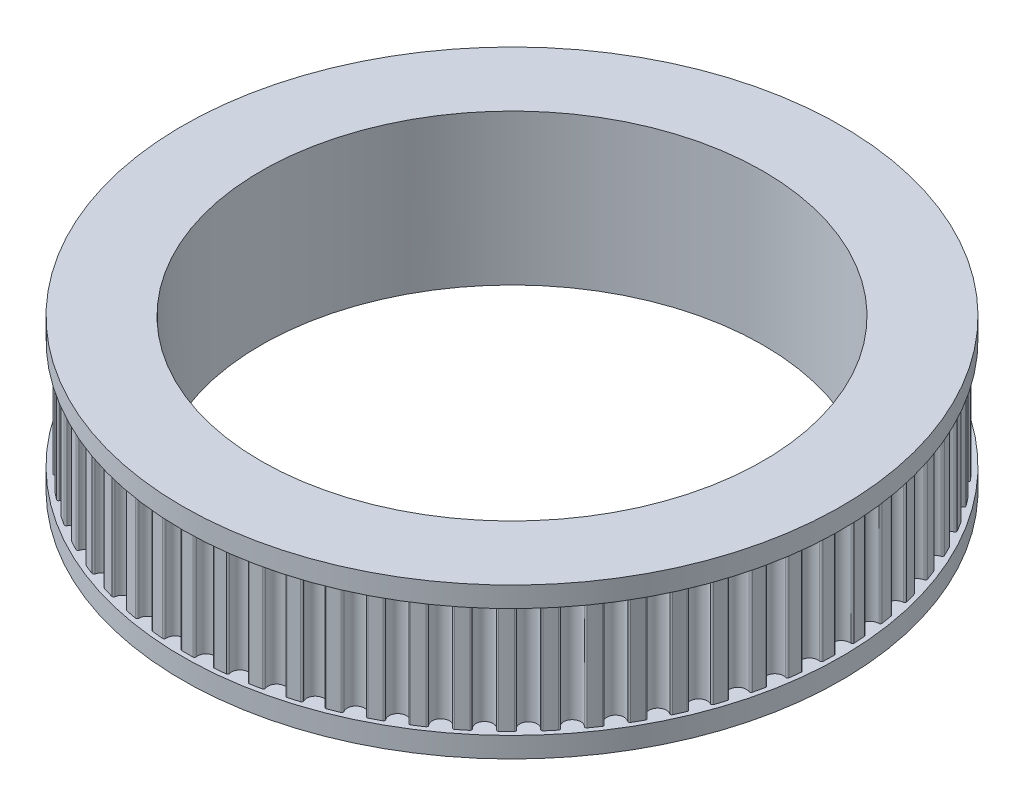
from build123d import *

# Parameters (mm, degrees)
SKETCH1_R                = 20.6901426
SKETCH1_R_2              = 16
BOSS_EXTRUDE1_DEPTH      = 7
CUT_EXTRUDE1_DEPTH       = 31.085943589
FILLET1_R                = 0.1
CIRPATTERN1_COUNT        = 65
FILLET1_OF_CIRPATTERN1_R = 0.1
SKETCH3_R                = 21
SKETCH3_R_2              = 16
BOSS_EXTRUDE2_DEPTH      = 1.3
BOSS_EXTRUDE3_START      = 1.3
SKETCH4_R                = 21
SKETCH4_R_2              = 16
BOSS_EXTRUDE3_DEPTH      = 1.3


with BuildPart() as part:
    # Sketch1 → Boss-Extrude1 (new body)
    with BuildSketch(Plane(origin=(0, 0, 0), x_dir=(1, 0, 0), z_dir=(0, 1, 0))):
        Circle(SKETCH1_R)
        Circle(SKETCH1_R_2, mode=Mode.SUBTRACT)
    extrude(amount=BOSS_EXTRUDE1_DEPTH)

    # Sketch2 → Cut-Extrude1 (cut, through all)
    with BuildSketch(Plane(origin=(0, 7, 0), x_dir=(1, 0, 0), z_dir=(0, 1, 0))):
        with BuildLine():
            ThreePointArc((-0.518485138, 20.683645084), (0, 19.9501426), (0.518485138, 20.683645084))
            ThreePointArc((0.518485138, 20.683645084), (0, 20.6901426), (-0.518485138, 20.683645084))
        make_face()
    cut_extrude1 = extrude(amount=-CUT_EXTRUDE1_DEPTH, mode=Mode.SUBTRACT)

    # Fillet1
    fillet1_edges = [part.edges().sort_by_distance(p)[0] for p in [
        (0.518485138, 3.5, -20.683645084),
        (-0.518485138, 3.5, -20.683645084),
    ]]
    fillet(fillet1_edges, radius=FILLET1_R)

    # CirPattern1: Cut-Extrude1 ×65 about axis
    cirpattern1_axis = Axis((0, 7, 0), (0, 1, 0))
    for i in range(1, CIRPATTERN1_COUNT):
        add(cut_extrude1.rotate(cirpattern1_axis, i * 360 / CIRPATTERN1_COUNT), mode=Mode.SUBTRACT)

    # Fillet1 of CirPattern1
    fillet1_of_cirpattern1_edges = [part.edges().sort_by_distance(p)[0] for p in [
        (-1.480195026, 3.5, -20.637127307),
        (-2.512324346, 3.5, -20.53704524),
        (-3.465055008, 3.5, -20.397926233),
        (-4.482706658, 3.5, -20.198696538),
        (-5.417562704, 3.5, -19.968275217),
        (-6.411235146, 3.5, -19.671758048),
        (-7.319488078, 3.5, -19.352185796),
        (-8.279903659, 3.5, -18.961149654),
        (-9.153073363, 3.5, -18.55541023),
        (-10.071264943, 3.5, -18.073506114),
        (-10.901198869, 3.5, -17.585387799),
        (-11.768593539, 3.5, -17.017115118),
        (-12.547542818, 3.5, -16.451175339),
        (-13.356041948, 3.5, -15.801839902),
        (-14.07673374, 3.5, -15.163362688),
        (-14.818788592, 3.5, -14.439027165),
        (-15.474493992, 3.5, -13.733973805),
        (-16.1431762, 3.5, -12.941401122),
        (-16.727773064, 3.5, -12.176354509),
        (-17.316839321, 3.5, -11.322944703),
        (-17.824869425, 3.5, -10.505047872),
        (-18.328819779, 3.5, -9.598769),
        (-18.755539783, 3.5, -8.735658434),
        (-19.169668985, 3.5, -7.784972178),
        (-19.511094719, 3.5, -6.884706506),
        (-19.831536157, 3.5, -5.898489168),
        (-20.084479821, 3.5, -4.969473928),
        (-20.308241619, 3.5, -3.956933553),
        (-20.470341547, 3.5, -3.007842712),
        (-20.595334501, 3.5, -1.978433116),
        (-20.665077208, 3.5, -1.018128078),
        (-20.690134294, 3.5, 0.018539417),
        (-20.666868612, 3.5, 0.981092543),
        (-20.591755877, 3.5, 2.015338853),
        (-20.475699032, 3.5, 2.971152968),
        (-20.301117784, 3.5, 3.993321614),
        (-20.093353367, 3.5, 4.933472537),
        (-19.820933625, 3.5, 5.934019806),
        (-19.523401475, 3.5, 6.849729603),
        (-19.155686748, 3.5, 7.819313654),
        (-18.771164845, 3.5, 8.702032589),
        (-18.311588385, 3.5, 9.631600678),
        (-17.843666905, 3.5, 10.473087042),
        (-17.296519656, 3.5, 11.353960041),
        (-16.749567456, 3.5, 12.146357102),
        (-16.119957982, 3.5, 12.970310538),
        (-15.499081808, 3.5, 13.706219899),
        (-14.792888605, 3.5, 14.46556074),
        (-14.103885409, 3.5, 15.138111414),
        (-13.327702012, 3.5, 15.8257499),
        (-12.577004832, 3.5, 16.428662461),
        (-11.738078256, 3.5, 17.038178296),
        (-10.93269615, 3.5, 17.565823513),
        (-10.038859227, 3.5, 18.091525813),
        (-9.186311829, 3.5, 18.538977204),
        (-8.245910073, 3.5, 18.975957627),
        (-7.35415739, 3.5, 19.33903746),
        (-6.375971079, 3.5, 19.683216038),
        (-5.453339165, 3.5, 19.958534334),
        (-4.446501361, 3.5, 20.206697564),
        (-3.501604582, 3.5, 20.39168375),
        (-2.475515858, 3.5, 20.5415146),
        (-1.51717646, 3.5, 20.634441509),
        (-0.48141713, 3.5, 20.684541048),
        (0.48141713, 3.5, 20.684541048),
        (1.51717646, 3.5, 20.634441509),
        (2.475515858, 3.5, 20.5415146),
        (3.501604582, 3.5, 20.39168375),
        (4.446501361, 3.5, 20.206697564),
        (5.453339165, 3.5, 19.958534334),
        (6.375971079, 3.5, 19.683216038),
        (7.35415739, 3.5, 19.33903746),
        (8.245910073, 3.5, 18.975957627),
        (9.186311829, 3.5, 18.538977204),
        (10.038859227, 3.5, 18.091525813),
        (10.93269615, 3.5, 17.565823513),
        (11.738078256, 3.5, 17.038178296),
        (12.577004832, 3.5, 16.428662461),
        (13.327702012, 3.5, 15.8257499),
        (14.103885409, 3.5, 15.138111414),
        (14.792888605, 3.5, 14.46556074),
        (15.499081808, 3.5, 13.706219899),
        (16.119957982, 3.5, 12.970310538),
        (16.749567456, 3.5, 12.146357102),
        (17.296519656, 3.5, 11.353960041),
        (17.843666905, 3.5, 10.473087042),
        (18.311588385, 3.5, 9.631600678),
        (18.771164845, 3.5, 8.702032589),
        (19.155686748, 3.5, 7.819313654),
        (19.523401475, 3.5, 6.849729603),
        (19.820933625, 3.5, 5.934019806),
        (20.093353367, 3.5, 4.933472537),
        (20.301117784, 3.5, 3.993321614),
        (20.475699032, 3.5, 2.971152968),
        (20.591755877, 3.5, 2.015338853),
        (20.666868612, 3.5, 0.981092543),
        (20.690134294, 3.5, 0.018539417),
        (20.665077208, 3.5, -1.018128078),
        (20.595334501, 3.5, -1.978433116),
        (20.470341547, 3.5, -3.007842712),
        (20.308241619, 3.5, -3.956933553),
        (20.084479821, 3.5, -4.969473928),
        (19.831536157, 3.5, -5.898489168),
        (19.511094719, 3.5, -6.884706506),
        (19.169668985, 3.5, -7.784972178),
        (18.755539783, 3.5, -8.735658434),
        (18.328819779, 3.5, -9.598769),
        (17.824869425, 3.5, -10.505047872),
        (17.316839321, 3.5, -11.322944703),
        (16.727773064, 3.5, -12.176354509),
        (16.1431762, 3.5, -12.941401122),
        (15.474493992, 3.5, -13.733973805),
        (14.818788592, 3.5, -14.439027165),
        (14.07673374, 3.5, -15.163362688),
        (13.356041948, 3.5, -15.801839902),
        (12.547542818, 3.5, -16.451175339),
        (11.768593539, 3.5, -17.017115118),
        (10.901198869, 3.5, -17.585387799),
        (10.071264943, 3.5, -18.073506114),
        (9.153073363, 3.5, -18.55541023),
        (8.279903659, 3.5, -18.961149654),
        (7.319488078, 3.5, -19.352185796),
        (6.411235146, 3.5, -19.671758048),
        (5.417562704, 3.5, -19.968275217),
        (4.482706658, 3.5, -20.198696538),
        (3.465055008, 3.5, -20.397926233),
        (2.512324346, 3.5, -20.53704524),
        (1.480195026, 3.5, -20.637127307),
    ]]
    fillet(fillet1_of_cirpattern1_edges, radius=FILLET1_OF_CIRPATTERN1_R)

    # Sketch3 → Boss-Extrude2 (add)
    with BuildSketch(Plane(origin=(0, 7, 0), x_dir=(1, 0, 0), z_dir=(0, 1, 0))):
        Circle(SKETCH3_R)
        Circle(SKETCH3_R_2, mode=Mode.SUBTRACT)
    extrude(amount=BOSS_EXTRUDE2_DEPTH)

    # Sketch4 → Boss-Extrude3 (add)
    with BuildSketch(Plane.XZ.offset(BOSS_EXTRUDE3_START)):
        Circle(SKETCH4_R)
        Circle(SKETCH4_R_2, mode=Mode.SUBTRACT)
    extrude(amount=-BOSS_EXTRUDE3_DEPTH)


solid = part.part
